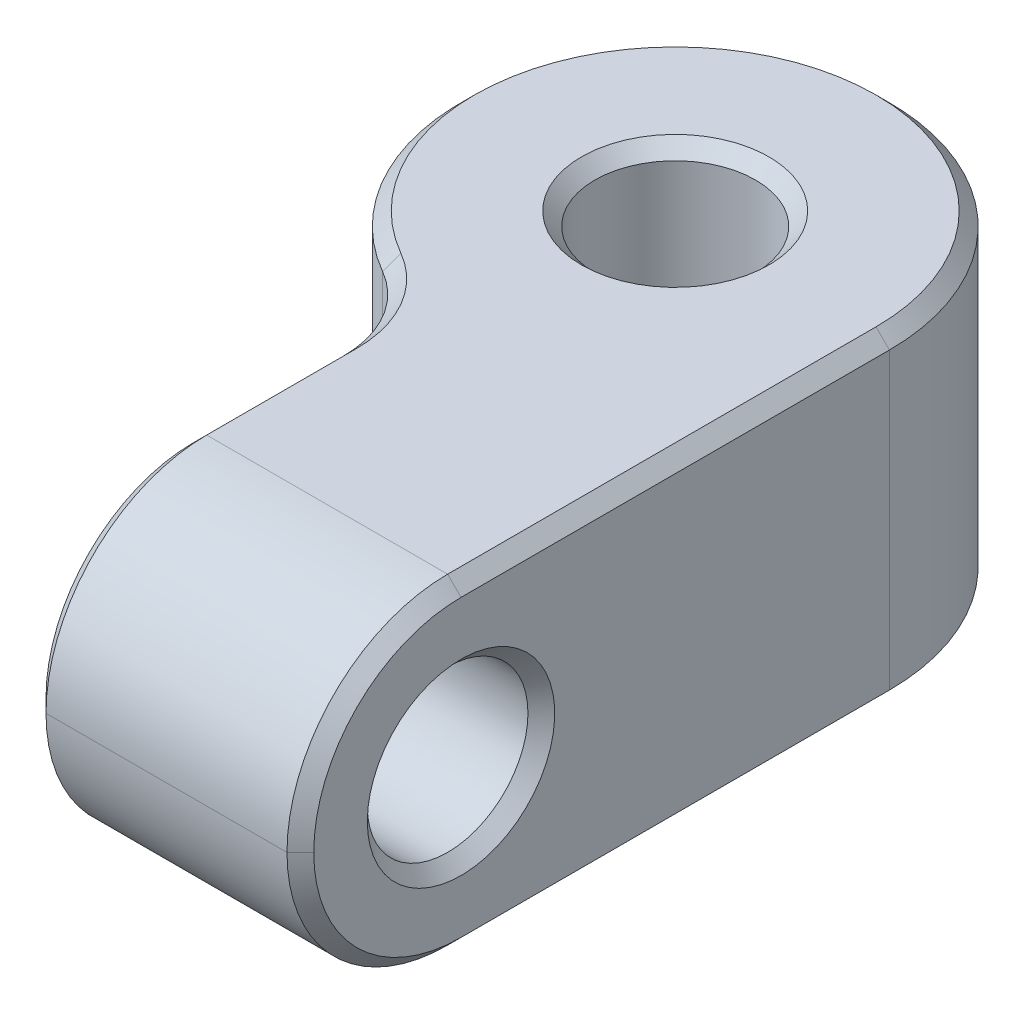
from build123d import *

# Parameters (mm, degrees)
SKETCH1_R               = 2.38125
BOSS_EXTRUDE1_DEPTH     = 9.525
CUT_EXTRUDE3_DEPTH      = 24.599884136
CUT_EXTRUDE3_DEPTH_BACK = 24.599884136
SKETCH5_R               = 2.38125
FILLET1_R               = 4.7625
FILLET2_R               = 3.175
CHAMFER1_SIZE           = 0.396875


with BuildPart() as part:
    # Sketch1 → Boss-Extrude1 (new body)
    with BuildSketch(Plane(origin=(0, 0, 0), x_dir=(1, 0, 0), z_dir=(0, 1, 0))):
        with BuildLine():
            Line((-1.5875, -17.4625), (-1.5875, -6.148361062))
            ThreePointArc((-1.5875, -6.148361062), (-3.888564967, 5.020115786), (6.35, 0))
            Line((6.35, 0), (6.35, -17.4625))
            Line((6.35, -17.4625), (-1.5875, -17.4625))
        make_face()
        with Locations(Location((0, 0, 0), (0, 0, 90))):
            Circle(SKETCH1_R, mode=Mode.SUBTRACT)
    extrude(amount=BOSS_EXTRUDE1_DEPTH)

    # Sketch5 → Cut-Extrude3 (cut, two sides: drawn at the far end of the back side and taken through both)
    with BuildSketch(Plane(origin=(6.35, 0, 0), x_dir=(0, 0, -1), z_dir=(1, 0, 0)).offset(-CUT_EXTRUDE3_DEPTH_BACK)):
        with Locations((-12.7, 4.7625)):
            Circle(SKETCH5_R)
    extrude(amount=CUT_EXTRUDE3_DEPTH + CUT_EXTRUDE3_DEPTH_BACK, mode=Mode.SUBTRACT)

    # Fillet1
    fillet1_edges = [part.edges().sort_by_distance(p)[0] for p in [
        (2.38125, 0, 17.4625),
        (2.38125, 9.525, 17.4625),
    ]]
    fillet(fillet1_edges, radius=FILLET1_R - 0.0001)  # a hair under: the kernel refuses the full size

    # Fillet2
    fillet2_edges = [part.edges().sort_by_distance(p)[0] for p in [
        (-1.5875, 4.7625, 6.148361062),
    ]]
    fillet(fillet2_edges, radius=FILLET2_R)

    # Chamfer1
    chamfer1_edges = [part.edges().sort_by_distance(p)[0] for p in [
        (0, 0, 2.38125),
        (0, 9.525, 2.38125),
        (-3.175, 9.525, -5.499261314),
        (-1.5875, 4.7625, 15.08125),
        (6.35, 4.7625, 15.08125),
        (6.35, 0, 6.35005),
        (6.35, 9.525, 6.35005),
        (6.35, 8.130125335, 16.067625335),
        (6.35, 1.394874665, 16.067625335),
        (-1.5875, 8.130125335, 16.067625335),
        (-1.5875, 1.394874665, 16.067625335),
        (-1.5875, 0, 10.474495986),
        (-1.5875, 9.525, 10.474495986),
        (-2.012869343, 0, 6.661391971),
        (-2.012869343, 9.525, 6.661391971),
        (-3.175, 0, -5.499261314),
    ]]
    chamfer(chamfer1_edges, length=CHAMFER1_SIZE)


solid = part.part
